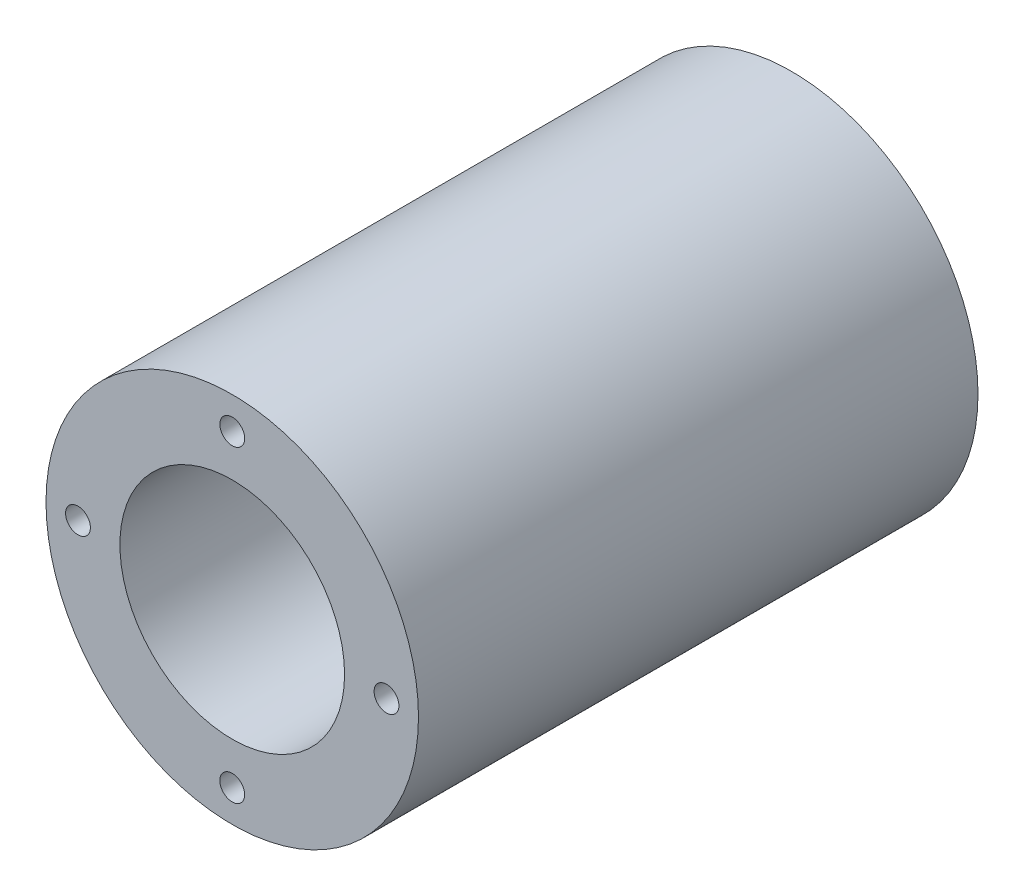
from build123d import *

# Parameters (mm, degrees)
SKETCH1_W              = 112.659
SKETCH1_H              = 14.8813
BACKFACEPATTERN_COUNT  = 6
FRONTFACEPATTERN_COUNT = 4
SKETCH7_R              = 26.9875
SKETCH7_R_2            = 24.60625
CUT_EXTRUDE1_DEPTH     = 0.5


with BuildPart() as part:
    # Sketch1 → Revolve1 (revolve)
    with BuildSketch(Plane(origin=(0, 0, 0), x_dir=(0, 0, -1), z_dir=(1, 0, 0))):
        with Locations((-79.9545, 30.05935)):
            Rectangle(SKETCH1_W, SKETCH1_H)
    revolve(axis=Axis((0, 0, 136.284), (0, 0, -1)))

    # Sketch9 → M6x1.0 Tapped Hole3 (revolve, cut)
    with BuildSketch(Plane(origin=(0, 31.05935, 23.625), x_dir=(0, 1, 0), z_dir=(1, 0, 0))):
        Polygon((0, 0), (0, 16.502151548), (2.5, 15), (2.5, 0), align=None)
    m6x1_0_tapped_hole3 = revolve(axis=Axis((0, 31.05935, 17.275), (0, 0, 1)), mode=Mode.SUBTRACT)

    # BackFacePattern: M6x1.0 Tapped Hole3 ×6 about axis
    backfacepattern_axis = Axis((0, 0, 1000), (0, 0, -1))
    for i in range(1, BACKFACEPATTERN_COUNT):
        add(m6x1_0_tapped_hole3.rotate(backfacepattern_axis, i * 360 / BACKFACEPATTERN_COUNT), mode=Mode.SUBTRACT)

    # Sketch6 → M6x1.0 Tapped Hole2 (revolve, cut)
    with BuildSketch(Plane(origin=(0, 31.05935, 136.284), x_dir=(0, -1, 0), z_dir=(1, 0, 0))):
        Polygon((0, 0), (0, 16.502151548), (2.5, 15), (2.5, 0), align=None)
    m6x1_0_tapped_hole2 = revolve(axis=Axis((0, 31.05935, 142.634), (0, 0, -1)), mode=Mode.SUBTRACT)

    # FrontFacePattern: M6x1.0 Tapped Hole2 ×4 about axis
    frontfacepattern_axis = Axis((0, 0, 1000), (0, 0, -1))
    for i in range(1, FRONTFACEPATTERN_COUNT):
        add(m6x1_0_tapped_hole2.rotate(frontfacepattern_axis, i * 360 / FRONTFACEPATTERN_COUNT), mode=Mode.SUBTRACT)

    # Sketch7 → Cut-Extrude1 (cut)
    with BuildSketch(Plane(origin=(0, 0, 23.625), x_dir=(-1, 0, 0), z_dir=(0, 0, -1))):
        Circle(SKETCH7_R)
        Circle(SKETCH7_R_2, mode=Mode.SUBTRACT)
    extrude(amount=-CUT_EXTRUDE1_DEPTH, mode=Mode.SUBTRACT)


solid = part.part
